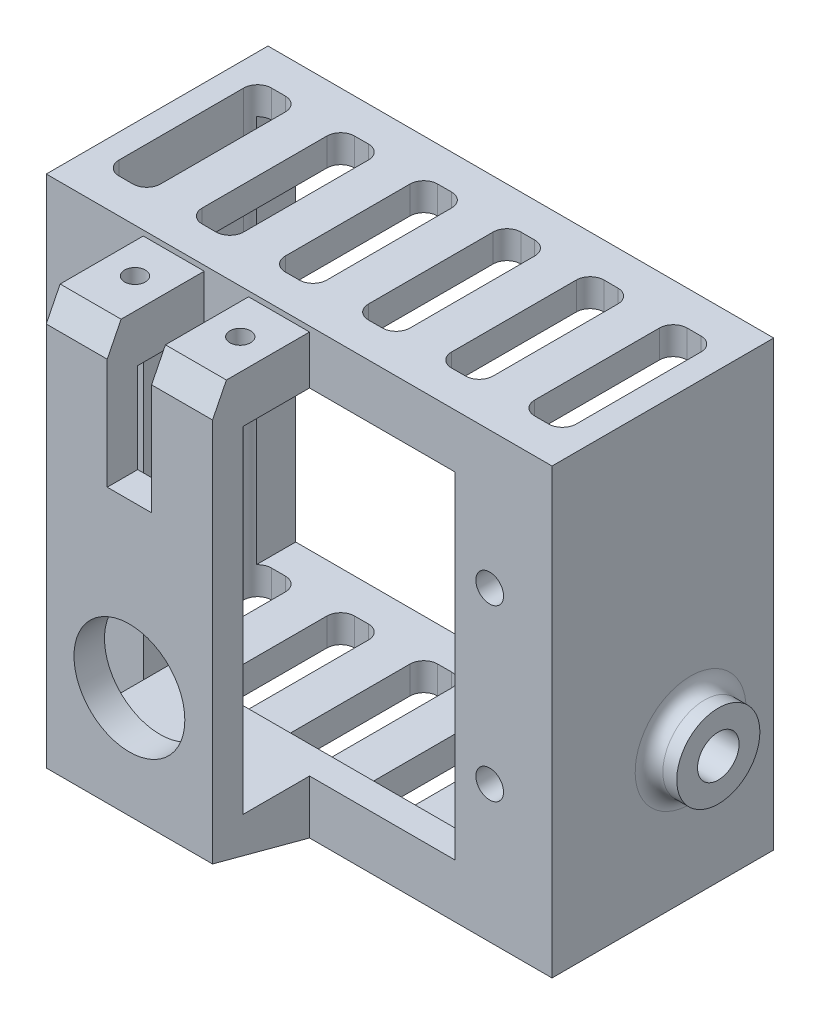
from build123d import *
from OCP.BRepFilletAPI import BRepFilletAPI_MakeChamfer

# Parameters (mm, degrees)
SKETCH_1_W          = 32.5
SKETCH_1_H          = 32
SKETCH_1_R          = 1
SKETCH_1_W_2        = 22.5
SKETCH_1_H_2        = 24.25
EXTRUDE_1_DEPTH     = 2
SKETCH_2_W          = 12
SKETCH_2_H          = 12
SKETCH_2_R          = 4
EXTRUDE_2_DEPTH     = 2.2
EXTRUDE_3_DEPTH     = 12
EXTRUDE_4_DEPTH     = 12
SKETCH_5_W          = 32.5
SKETCH_5_H          = 2
EXTRUDE_5_DEPTH     = 14
SKETCH_7_W          = 2
SKETCH_7_H          = 32
EXTRUDE_6_DEPTH     = 16
SKETCH_9_R          = 3.625
CUT_EXTRUDE_1_DEPTH = 1
SKETCH_10_R         = 2.25
CUT_EXTRUDE_2_DEPTH = 1
EXTRUDE_START       = -2
SKETCH_11_R         = 5
SKETCH_11_R_2       = 3.625
EXTRUDE_7_DEPTH     = 2
FILLET_1_R          = 1
SKETCH_12_R         = 3
SKETCH_12_R_2       = 1.5
EXTRUDE_8_DEPTH     = 2
FILLET_2_R          = 1
CUT_EXTRUDE_START   = 2
SKETCH_13_R         = 1.5
CUT_EXTRUDE_3_DEPTH = 2
SKETCH_19_W         = 3.200973594
SKETCH_19_H         = 7
CUT_EXTRUDE_7_DEPTH = 10
CUT_EXTRUDE_8_DEPTH = 42
SKETCH_22_R         = 0.75
CUT_EXTRUDE_9_DEPTH = 5
CHAMFER_1_SIZE      = 1
CHAMFER_1_SIZE2     = 2


with BuildPart() as part:
    # 草图1 → 凸台-拉伸1 (new body)
    with BuildSketch(Plane.XY):
        with Locations((-5.25, -6.125)):
            Rectangle(SKETCH_1_W, SKETCH_1_H)
        with Locations((-19, 0)):
            Circle(SKETCH_1_R, mode=Mode.SUBTRACT)
        with Locations(Location((8.5, 0, 0), (0, 0, 180))):
            Circle(SKETCH_1_R, mode=Mode.SUBTRACT)
        with Locations(Location((-19, -12.25, 0), (0, 0, 180))):
            Circle(SKETCH_1_R, mode=Mode.SUBTRACT)
        with Locations((8.5, -12.25)):
            Circle(SKETCH_1_R, mode=Mode.SUBTRACT)
        with Locations((-5.25, -6.125)):
            Rectangle(SKETCH_1_W_2, SKETCH_1_H_2, mode=Mode.SUBTRACT)
    extrude(amount=EXTRUDE_1_DEPTH)



with BuildPart() as body_2:
    # 草图2 → 凸台-拉伸2 (new body)
    with BuildSketch(Plane.XY.offset(9)):
        with Locations((-10.5, -12.25)):
            Rectangle(SKETCH_2_W, SKETCH_2_H)
        with Locations((-10.5, -12.25)):
            Circle(SKETCH_2_R, mode=Mode.SUBTRACT)
    extrude(amount=-EXTRUDE_2_DEPTH)


with BuildPart() as part_1:
    add(part.part)

    add(body_2.part)  # 凸台-拉伸3 merges body 2
    # 草图3 → 凸台-拉伸3 (add)
    with BuildSketch(Plane.ZY.offset(16.5)):
        Polygon((9, -18.25), (2, -18.25), (2, -22.125), (9, -20.25), align=None)
    extrude(amount=-EXTRUDE_3_DEPTH)

    # 草图4 → 凸台-拉伸4 (add)
    with BuildSketch(Plane.ZY.offset(16.5)):
        Polygon((6.8, -6.25), (9, -6.25), (9, 9.5), (2, 9.5), (2, 6), (6.8, 6), align=None)
    extrude(amount=-EXTRUDE_4_DEPTH)

    # 草图5 → 凸台-拉伸5 (add)
    with BuildSketch(Plane(origin=(0, 0, 0), x_dir=(-1, 0, 0), z_dir=(0, 0, -1))):
        with Locations((5.25, 8.875)):
            Rectangle(SKETCH_5_W, SKETCH_5_H)
        with Locations((5.25, -21.125)):
            Rectangle(SKETCH_5_W, SKETCH_5_H)
    extrude(amount=EXTRUDE_5_DEPTH)

    # 草图7 → 凸台-拉伸6 (add)
    with BuildSketch(Plane.XY.offset(2)):
        with Locations((-22.5, -6.125)):
            Rectangle(SKETCH_7_W, SKETCH_7_H)
        with Locations((12, -6.125)):
            Rectangle(SKETCH_7_W, SKETCH_7_H)
    extrude(amount=-EXTRUDE_6_DEPTH)

    # 草图9 → 切除-拉伸1 (cut)
    with BuildSketch(Plane(origin=(-23.5, 0, 0), x_dir=(0, 0, -1), z_dir=(1, 0, 0))):
        with Locations(Location((8, -12.25, 0), (0, 0, 90))):
            Circle(SKETCH_9_R)
    extrude(amount=CUT_EXTRUDE_1_DEPTH, mode=Mode.SUBTRACT)

    # 草图10 → 切除-拉伸2 (cut)
    with BuildSketch(Plane.ZY.offset(22.5)):
        with Locations(Location((-8, -12.25, 0), (0, 0, 270))):
            Circle(SKETCH_10_R)
    extrude(amount=-CUT_EXTRUDE_2_DEPTH, mode=Mode.SUBTRACT)

    # 草图11 → 凸台-拉伸7 (add)
    with BuildSketch(Plane(origin=(-23.5, 0, 0), x_dir=(0, 0, -1), z_dir=(1, 0, 0)).offset(EXTRUDE_START)):
        with Locations(Location((8, -12.25, 0), (0, 0, 90))):
            Circle(SKETCH_11_R)
        with Locations(Location((8, -12.25, 0), (0, 0, 90))):
            Circle(SKETCH_11_R_2, mode=Mode.SUBTRACT)
    extrude(amount=EXTRUDE_7_DEPTH)

    # 圆角1
    fillet_1_edges = [part_1.edges().sort_by_distance(p)[0] for p in [
        (-23.5, -17.25, -8),
    ]]
    fillet(fillet_1_edges, radius=FILLET_1_R - 0.0001)  # a hair under: the kernel refuses the full size

    # 草图12 → 凸台-拉伸8 (add)
    with BuildSketch(Plane.ZY.offset(-13)):
        with Locations(Location((-8, -12.25, 0), (0, 0, 270))):
            Circle(SKETCH_12_R)
        with Locations(Location((-8, -12.25, 0), (0, 0, 270))):
            Circle(SKETCH_12_R_2, mode=Mode.SUBTRACT)
    extrude(amount=-EXTRUDE_8_DEPTH)

    # 圆角2
    fillet_2_edges = [part_1.edges().sort_by_distance(p)[0] for p in [
        (13, -9.25, -8),
    ]]
    fillet(fillet_2_edges, radius=FILLET_2_R)

    # 草图13 → 切除-拉伸3 (cut)
    with BuildSketch(Plane.ZY.offset(-13).offset(CUT_EXTRUDE_START)):
        with Locations(Location((-8, -12.25, 0), (0, 0, 270))):
            Circle(SKETCH_13_R)
    extrude(amount=-CUT_EXTRUDE_3_DEPTH, mode=Mode.SUBTRACT)

    # 草图19 → 切除-拉伸7 (cut)
    with BuildSketch(Plane(origin=(0, 9.5, 0), x_dir=(1, 0, 0), z_dir=(0, 1, 0))):
        with Locations((-10.5, -5.5)):
            Rectangle(SKETCH_19_W, SKETCH_19_H)
    extrude(amount=-CUT_EXTRUDE_7_DEPTH, mode=Mode.SUBTRACT)

    # 草图20 → 切除-拉伸8 (cut)
    with BuildSketch(Plane(origin=(0, 9.875, 0), x_dir=(1, 0, 0), z_dir=(0, 1, 0))):
        with BuildLine():
            Line((-6.75, 10.5), (-6.75, 1.5))
            ThreePointArc((-6.75, 1.5), (-7.042893219, 0.792893219), (-7.75, 0.5))
            Line((-7.75, 0.5), (-8.75, 0.5))
            ThreePointArc((-8.75, 0.5), (-9.457106781, 0.792893219), (-9.75, 1.5))
            Line((-9.75, 1.5), (-9.75, 10.5))
            ThreePointArc((-9.75, 10.5), (-9.457106781, 11.207106781), (-8.75, 11.5))
            Line((-8.75, 11.5), (-7.75, 11.5))
            ThreePointArc((-7.75, 11.5), (-7.042893219, 11.207106781), (-6.75, 10.5))
        make_face()
        with BuildLine():
            Line((8.25, 10.5), (8.25, 1.5))
            ThreePointArc((8.25, 1.5), (8.542893219, 0.792893219), (9.25, 0.5))
            Line((9.25, 0.5), (10.25, 0.5))
            ThreePointArc((10.25, 0.5), (10.957106781, 0.792893219), (11.25, 1.5))
            Line((11.25, 1.5), (11.25, 10.5))
            ThreePointArc((11.25, 10.5), (10.957106781, 11.207106781), (10.25, 11.5))
            Line((10.25, 11.5), (9.25, 11.5))
            ThreePointArc((9.25, 11.5), (8.542893219, 11.207106781), (8.25, 10.5))
        make_face()
        with BuildLine():
            Line((-14.75, 11.5), (-13.75, 11.5))
            ThreePointArc((-13.75, 11.5), (-13.042893219, 11.207106781), (-12.75, 10.5))
            Line((-12.75, 10.5), (-12.75, 1.5))
            ThreePointArc((-12.75, 1.5), (-13.042893219, 0.792893219), (-13.75, 0.5))
            Line((-13.75, 0.5), (-14.75, 0.5))
            ThreePointArc((-14.75, 0.5), (-15.457106781, 0.792893219), (-15.75, 1.5))
            Line((-15.75, 1.5), (-15.75, 10.5))
            ThreePointArc((-15.75, 10.5), (-15.457106781, 11.207106781), (-14.75, 11.5))
        make_face()
        with BuildLine():
            Line((-20.75, 11.5), (-19.75, 11.5))
            ThreePointArc((-19.75, 11.5), (-19.042893219, 11.207106781), (-18.75, 10.5))
            Line((-18.75, 10.5), (-18.75, 1.5))
            ThreePointArc((-18.75, 1.5), (-19.042893219, 0.792893219), (-19.75, 0.5))
            Line((-19.75, 0.5), (-20.75, 0.5))
            ThreePointArc((-20.75, 0.5), (-21.457106781, 0.792893219), (-21.75, 1.5))
            Line((-21.75, 1.5), (-21.75, 10.5))
            ThreePointArc((-21.75, 10.5), (-21.457106781, 11.207106781), (-20.75, 11.5))
        make_face()
        with BuildLine():
            Line((2.25, 10.5), (2.25, 1.5))
            ThreePointArc((2.25, 1.5), (2.542893219, 0.792893219), (3.25, 0.5))
            Line((3.25, 0.5), (4.25, 0.5))
            ThreePointArc((4.25, 0.5), (4.957106781, 0.792893219), (5.25, 1.5))
            Line((5.25, 1.5), (5.25, 10.5))
            ThreePointArc((5.25, 10.5), (4.957106781, 11.207106781), (4.25, 11.5))
            Line((4.25, 11.5), (3.25, 11.5))
            ThreePointArc((3.25, 11.5), (2.542893219, 11.207106781), (2.25, 10.5))
        make_face()
        with BuildLine():
            Line((-1.75, 11.5), (-2.75, 11.5))
            ThreePointArc((-2.75, 11.5), (-3.457106781, 11.207106781), (-3.75, 10.5))
            Line((-3.75, 10.5), (-3.75, 1.5))
            ThreePointArc((-3.75, 1.5), (-3.457106781, 0.792893219), (-2.75, 0.5))
            Line((-2.75, 0.5), (-1.75, 0.5))
            ThreePointArc((-1.75, 0.5), (-1.042893219, 0.792893219), (-0.75, 1.5))
            Line((-0.75, 1.5), (-0.75, 10.5))
            ThreePointArc((-0.75, 10.5), (-1.042893219, 11.207106781), (-1.75, 11.5))
        make_face()
    extrude(amount=-CUT_EXTRUDE_8_DEPTH, mode=Mode.SUBTRACT)

    # 草图22 → 切除-拉伸9 (cut)
    with BuildSketch(Plane(origin=(0, 9.5, 0), x_dir=(1, 0, 0), z_dir=(0, 1, 0))):
        with Locations(Location((-6.7, -4.8, 0), (0, 0, 270))):
            Circle(SKETCH_22_R)
        with Locations((-14.3, -4.8)):
            Circle(SKETCH_22_R)
    extrude(amount=-CUT_EXTRUDE_9_DEPTH, mode=Mode.SUBTRACT)

    # 倒角1: one chamfer whose edges measure the first distance from different faces: ONE call of the kernel's chamfer builder (chamfer() names one face for all edges)
    chamfer_1_edges_1 = [part_1.edges().sort_by_distance(p)[0] for p in [
        (-14.300243398, 9.5, 9),
    ]]
    chamfer_1_side_1 = [part_1.faces().sort_by_distance(p)[0] for p in [
        (-16.417322484, 9.5, 5.5),
    ]]
    chamfer_1_edges_2 = [part_1.edges().sort_by_distance(p)[0] for p in [
        (-6.699756602, 9.5, 9),
    ]]
    chamfer_1_side_2 = [part_1.faces().sort_by_distance(p)[0] for p in [
        (-8.816835687, 9.5, 5.5),
    ]]
    chamfer_1 = BRepFilletAPI_MakeChamfer(part_1.part.solid().wrapped)
    for e in chamfer_1_edges_1:
        chamfer_1.Add(CHAMFER_1_SIZE, CHAMFER_1_SIZE2, e.wrapped, chamfer_1_side_1[0].wrapped)  # the first distance lies on this face
    for e in chamfer_1_edges_2:
        chamfer_1.Add(CHAMFER_1_SIZE, CHAMFER_1_SIZE2, e.wrapped, chamfer_1_side_2[0].wrapped)  # the first distance lies on this face
    add(Compound.cast(chamfer_1.Shape()), mode=Mode.REPLACE)


solid = part_1.part
